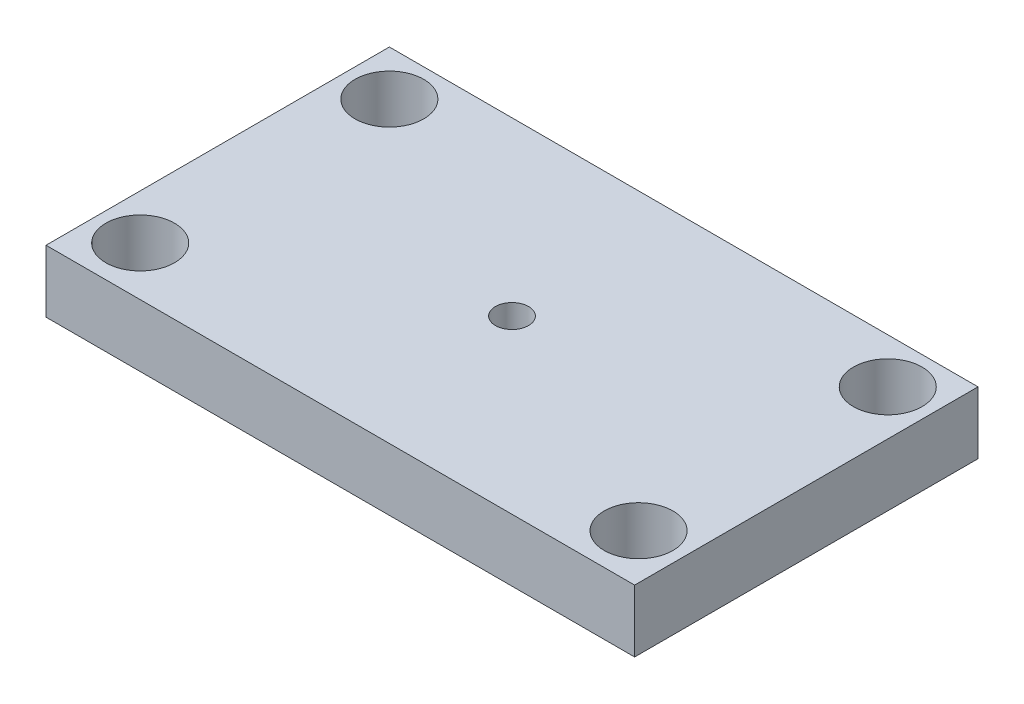
from build123d import *

# Parameters (mm, degrees)
SKETCH1_W           = 60
SKETCH1_H           = 35
SKETCH1_R           = 3.5
SKETCH1_R_2         = 1.6875
BOSS_EXTRUDE1_DEPTH = 6.35


with BuildPart() as part:
    # Sketch1 → Boss-Extrude1 (new body)
    with BuildSketch(Plane(origin=(0, 0, 0), x_dir=(1, 0, 0), z_dir=(0, 1, 0))):
        with Locations((30, 17.5)):
            Rectangle(SKETCH1_W, SKETCH1_H)
        with Locations((4.6, 30.4)):
            Circle(SKETCH1_R, mode=Mode.SUBTRACT)
        with Locations((55.4, 30.4)):
            Circle(SKETCH1_R, mode=Mode.SUBTRACT)
        with Locations((4.6, 5)):
            Circle(SKETCH1_R, mode=Mode.SUBTRACT)
        with Locations((55.4, 5)):
            Circle(SKETCH1_R, mode=Mode.SUBTRACT)
        with Locations((30, 17.5)):
            Circle(SKETCH1_R_2, mode=Mode.SUBTRACT)
    extrude(amount=BOSS_EXTRUDE1_DEPTH)


solid = part.part
